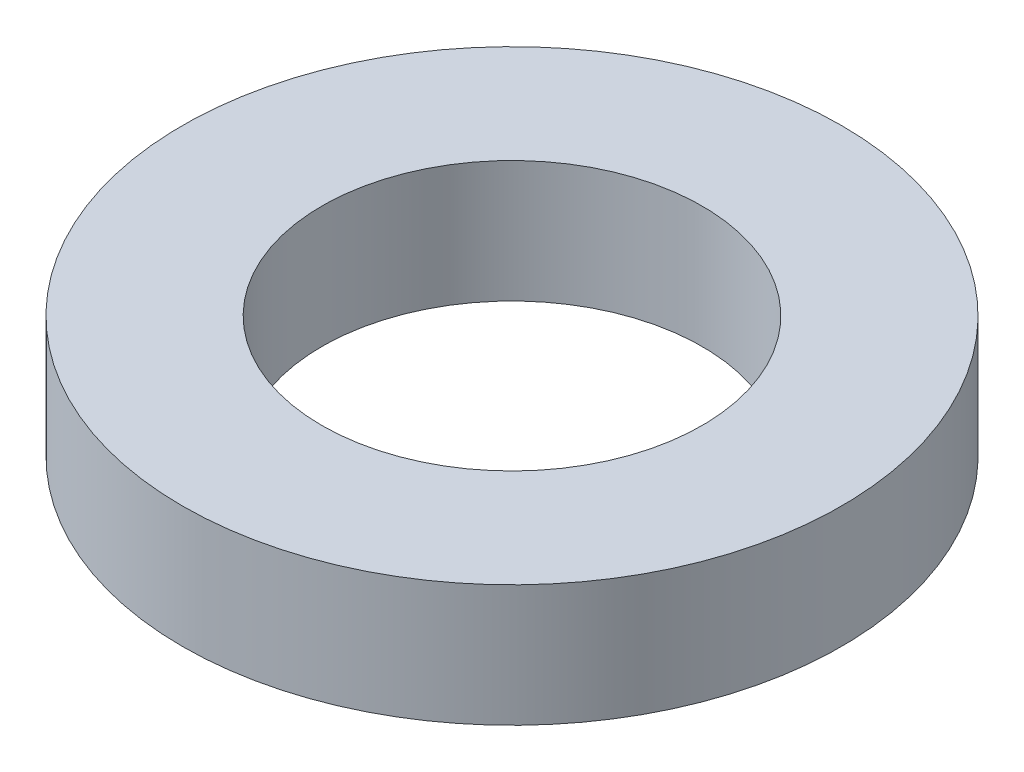
from build123d import *

# Parameters (mm, degrees)
SKETCH1_R           = 65
BOSS_EXTRUDE1_DEPTH = 24
SKETCH2_R           = 37.5
CUT_EXTRUDE1_DEPTH  = 96.005263012


with BuildPart() as part:
    # Sketch1 → Boss-Extrude1 (new body)
    with BuildSketch(Plane(origin=(0, 0, 0), x_dir=(1, 0, 0), z_dir=(0, 1, 0))):
        Circle(SKETCH1_R)
    extrude(amount=BOSS_EXTRUDE1_DEPTH)

    # Sketch2 → Cut-Extrude1 (cut, through all)
    with BuildSketch(Plane(origin=(0, 0, 0), x_dir=(1, 0, 0), z_dir=(0, 1, 0))):
        Circle(SKETCH2_R)
    extrude(amount=CUT_EXTRUDE1_DEPTH, mode=Mode.SUBTRACT)


solid = part.part
